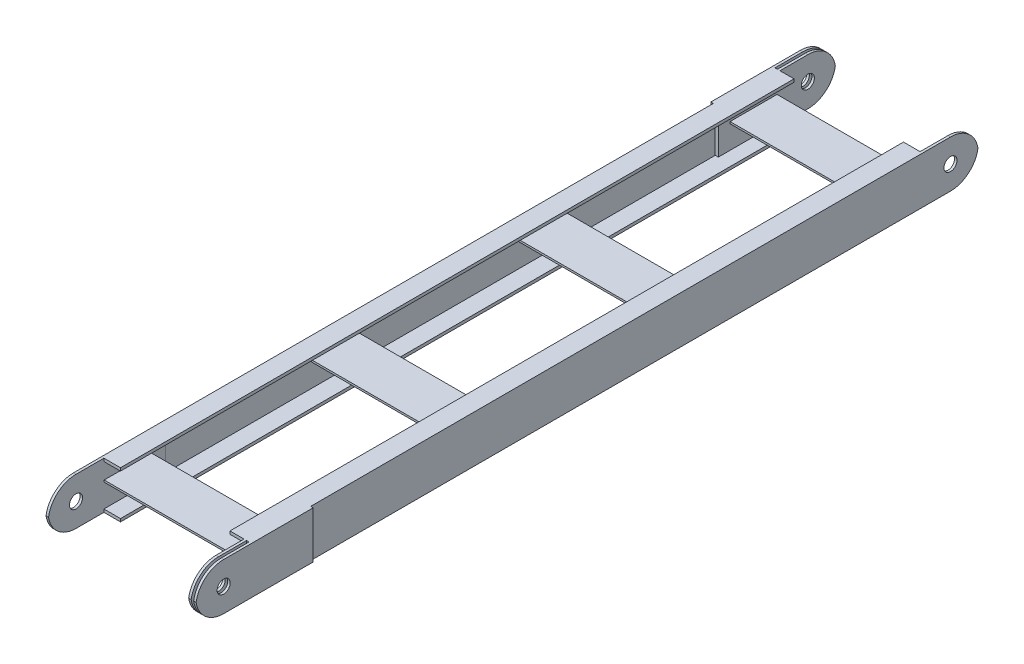
from build123d import *

# Parameters (mm, degrees)
EXTRUDE_1_DEPTH        = 2675
EXTRUDE_1_2_DEPTH      = 2675
EXTRUDE_3_DEPTH        = 503
SKETCH_6_W             = 486
SKETCH_6_H             = 190
CUT_EXTRUDE_4_DEPTH    = 2727.57917545
PATTERN_LINEAR_1_COUNT = 4
PATTERN_LINEAR_1_PITCH = 708
SKETCH_7_W             = 400
SKETCH_7_H             = 140
EXTRUDE_5_DEPTH        = 2
SKETCH_15_W            = 400
SKETCH_15_H            = 140
EXTRUDE_8_DEPTH        = 2
SKETCH_19_W            = 400
SKETCH_19_H            = 160
EXTRUDE_11_DEPTH       = 8.5
PATTERN_LINEAR_2_COUNT = 2
PATTERN_LINEAR_2_PITCH = 17
SKETCH_22_W            = 8.5
SKETCH_22_H            = 190
CUT_EXTRUDE_12_DEPTH   = 2729.160048458
SKETCH_23_R            = 11
SKETCH_23_R_2          = 22.25
CUT_EXTRUDE_13_DEPTH   = 2729.160048458
SKETCH_26_W            = 400
SKETCH_26_H            = 160
EXTRUDE_14_DEPTH       = 8.5
PATTERN_LINEAR_3_COUNT = 2
PATTERN_LINEAR_3_PITCH = 17
SKETCH_27_W            = 8.5
SKETCH_27_H            = 190
CUT_EXTRUDE_15_DEPTH   = 2729.160048458
SKETCH_28_R            = 22.25
CUT_EXTRUDE_16_DEPTH   = 2730.766473528
FILLET_2_R             = 95


with BuildPart() as part:
    # 草图2 → 拉伸1 (new body)
    with BuildSketch(Plane.XY):
        Polygon((0, 0), (0, 160), (65, 160), (65, 150), (6.5, 150), (6.5, 10), (65, 10), (65, 0), align=None)
    extrude(amount=EXTRUDE_1_DEPTH)



with BuildPart() as body_2:
    # 草图2 → Extrude 1 2 (new body)
    with BuildSketch(Plane.XY):
        Polygon((438, 160), (503, 160), (503, 0), (438, 0), (438, 10), (496.5, 10), (496.5, 150), (438, 150), align=None)
    extrude(amount=EXTRUDE_1_2_DEPTH)


with BuildPart() as part_1:
    add(part.part)

    add(body_2.part)  # 拉伸3 merges body 2
    # 草图5 → 拉伸3 (add)
    with BuildSketch(Plane.ZY):
        Polygon((200, 95), (360, 95), (360, 88.5), (283.25, 88.5), (283.25, 48.5), (276.75, 48.5), (276.75, 88.5), (200, 88.5), align=None)
    extrude_3 = extrude(amount=-EXTRUDE_3_DEPTH)

    # 草图6 → 拉伸4 (cut, through all)
    with BuildSketch(Plane(origin=(0, 160, 0), x_dir=(1, 0, 0), z_dir=(0, 1, 0))):
        with Locations((251.5, -95)):
            Rectangle(SKETCH_6_W, SKETCH_6_H)
        with Locations((251.5, -2580)):
            Rectangle(SKETCH_6_W, SKETCH_6_H)
    extrude(amount=-CUT_EXTRUDE_4_DEPTH, mode=Mode.SUBTRACT)

    # 阵列(线性)1: 拉伸3 ×4
    with Locations(*[(0, 0, i * PATTERN_LINEAR_1_PITCH) for i in range(1, PATTERN_LINEAR_1_COUNT)]):
        add(extrude_3)

    # 草图7 → 拉伸5 (add)
    with BuildSketch(Plane.ZY.offset(-496.5)):
        with Locations((200, 80)):
            Rectangle(SKETCH_7_W, SKETCH_7_H)
        with Locations((2475, 80)):
            Rectangle(SKETCH_7_W, SKETCH_7_H)
    extrude(amount=EXTRUDE_5_DEPTH)

    # 草图15 → 拉伸8 (add)
    with BuildSketch(Plane(origin=(6.5, 0, 0), x_dir=(0, 0, -1), z_dir=(1, 0, 0))):
        with Locations((-2475, 80)):
            Rectangle(SKETCH_15_W, SKETCH_15_H)
        with Locations((-200, 80)):
            Rectangle(SKETCH_15_W, SKETCH_15_H)
    extrude(amount=EXTRUDE_8_DEPTH)

    # 草图19 → 拉伸11 (add)
    with BuildSketch(Plane(origin=(503, 0, 0), x_dir=(0, 0, -1), z_dir=(1, 0, 0))):
        with Locations((-2475, 80)):
            Rectangle(SKETCH_19_W, SKETCH_19_H)
    extrude_11 = extrude(amount=EXTRUDE_11_DEPTH)

    # 阵列(线性)2: 拉伸11 ×2
    with Locations(*[(-i * PATTERN_LINEAR_2_PITCH, 0, 0) for i in range(1, PATTERN_LINEAR_2_COUNT)]):
        add(extrude_11)

    # 草图22 → 拉伸12 (cut, through all)
    with BuildSketch(Plane(origin=(0, 160, 0), x_dir=(1, 0, 0), z_dir=(0, 1, 0))):
        with Locations((498.75, -2580)):
            Rectangle(SKETCH_22_W, SKETCH_22_H)
    extrude(amount=-CUT_EXTRUDE_12_DEPTH, mode=Mode.SUBTRACT)

    # 草图23 → 拉伸13 (cut, through all)
    with BuildSketch(Plane.ZY):
        with Locations((95, 80)):
            Circle(SKETCH_23_R)
        with Locations(Location((2580, 80, 0), (0, 0, 180))):
            Circle(SKETCH_23_R_2)
    extrude(amount=-CUT_EXTRUDE_13_DEPTH, mode=Mode.SUBTRACT)

    # 草图26 → 拉伸14 (add)
    with BuildSketch(Plane.ZY):
        with Locations((200, 80)):
            Rectangle(SKETCH_26_W, SKETCH_26_H)
    extrude_14 = extrude(amount=EXTRUDE_14_DEPTH)

    # 阵列(线性)3: 拉伸14 ×2
    with Locations(*[(i * PATTERN_LINEAR_3_PITCH, 0, 0) for i in range(1, PATTERN_LINEAR_3_COUNT)]):
        add(extrude_14)

    # 草图27 → 拉伸15 (cut, through all)
    with BuildSketch(Plane(origin=(0, 160, 0), x_dir=(1, 0, 0), z_dir=(0, 1, 0))):
        with Locations((4.25, -95)):
            Rectangle(SKETCH_27_W, SKETCH_27_H)
    extrude(amount=-CUT_EXTRUDE_15_DEPTH, mode=Mode.SUBTRACT)

    # 草图28 → 拉伸16 (cut, through all)
    with BuildSketch(Plane.ZY.offset(8.5)):
        with Locations(Location((95, 80, 0), (0, 0, 180))):
            Circle(SKETCH_28_R)
    extrude(amount=-CUT_EXTRUDE_16_DEPTH, mode=Mode.SUBTRACT)

    # 圆角2
    # the kernel refuses this fillet: 95 mm, written as the material it takes off along each edge
    with BuildSketch(Plane(origin=(-237.5, 160, 2675), x_dir=(0, 0, -1), z_dir=(1, 0, 0)), Plane(origin=(749, 0, 2675), x_dir=(0, 0, -1), z_dir=(-1, 0, 0)), Plane(origin=(265.5, 160, 2675), x_dir=(0, 0, -1), z_dir=(1, 0, 0)), Plane(origin=(237.5, 160, 0), x_dir=(0, 0, 1), z_dir=(-1, 0, 0)), Plane(origin=(254.5, 160, 0), x_dir=(0, 0, 1), z_dir=(-1, 0, 0)), Plane(origin=(-246, 0, 0), x_dir=(0, 0, 1), z_dir=(1, 0, 0)), Plane(origin=(-229, 0, 0), x_dir=(0, 0, 1), z_dir=(1, 0, 0))) as fillet_2_piece_1:
        with BuildLine():
            CenterArc((FILLET_2_R, -FILLET_2_R), FILLET_2_R, 90, 90)
            Line((0, -FILLET_2_R), (0, 0))
            Line((0, 0), (FILLET_2_R, 0))
        make_face()
    extrude(amount=483.5, mode=Mode.SUBTRACT)
    with BuildSketch(Plane(origin=(246, 0, 2675), x_dir=(0, 1, 0), z_dir=(-1, 0, 0)), Plane(origin=(732, 0, 2675), x_dir=(0, 1, 0), z_dir=(-1, 0, 0)), Plane(origin=(248.5, 160, 2675), x_dir=(0, -1, 0), z_dir=(1, 0, 0)), Plane(origin=(257, 160, 0), x_dir=(0, 0, 1), z_dir=(1, 0, 0)), Plane(origin=(740.5, 0, 0), x_dir=(0, 0, 1), z_dir=(-1, 0, 0))) as fillet_2_piece_2:
        with BuildLine():
            CenterArc((FILLET_2_R, FILLET_2_R), FILLET_2_R, 180, 90)
            Line((0, FILLET_2_R), (0, 0))
            Line((0, 0), (FILLET_2_R, 0))
        make_face()
    extrude(amount=483.5, mode=Mode.SUBTRACT)


solid = part_1.part
